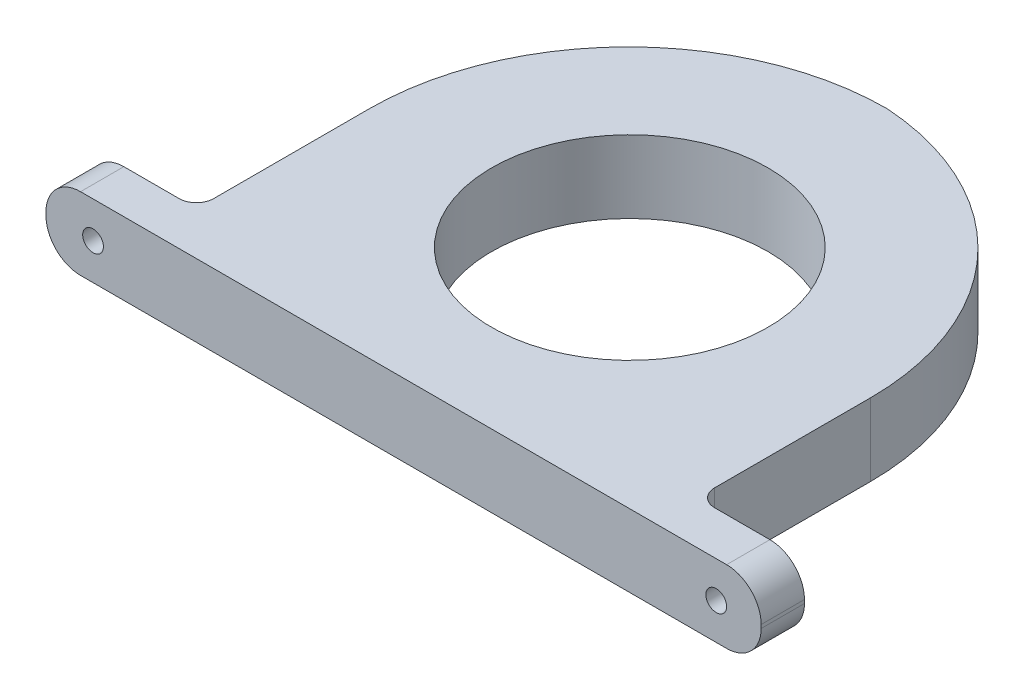
from build123d import *

# Parameters (mm, degrees)
SKETCH1_R           = 40
BOSS_EXTRUDE1_DEPTH = 21
FILLET1_R           = 10
FILLET2_R           = 10
FILLET3_R           = 10
FILLET4_R           = 10
FILLET5_R           = 5
FILLET6_R           = 5
FILLET7_R           = 75
FILLET8_R           = 75
SKETCH2_R           = 3
CUT_EXTRUDE1_DEPTH  = 164.836129338


with BuildPart() as part:
    # Sketch1 → Boss-Extrude1 (new body)
    with BuildSketch(Plane(origin=(0, 0, 0), x_dir=(1, 0, 0), z_dir=(0, 1, 0))):
        Polygon((0.191150297, -52.534941872), (103.191150297, -52.534941872), (103.191150297, -40), (72.191150297, -40), (72.191150297, 85), (0.191150297, 85), (-72.808849703, 85), (-72.808849703, -40), (-103.808849703, -40), (-103.808849703, -52.534941872), align=None)
        with Locations(Location((-0.308849703, 12.94638448, 0), (0, 0, 90))):
            Circle(SKETCH1_R, mode=Mode.SUBTRACT)
    extrude(amount=BOSS_EXTRUDE1_DEPTH)

    # Fillet1
    fillet1_edges = [part.edges().sort_by_distance(p)[0] for p in [
        (103.191150297, 21, 46.267470936),
    ]]
    fillet(fillet1_edges, radius=FILLET1_R)

    # Fillet2
    fillet2_edges = [part.edges().sort_by_distance(p)[0] for p in [
        (-103.808849703, 21, 46.267470936),
    ]]
    fillet(fillet2_edges, radius=FILLET2_R)

    # Fillet3
    fillet3_edges = [part.edges().sort_by_distance(p)[0] for p in [
        (-103.808849703, 0, 46.267470936),
    ]]
    fillet(fillet3_edges, radius=FILLET3_R)

    # Fillet4
    fillet4_edges = [part.edges().sort_by_distance(p)[0] for p in [
        (103.191150297, 0, 46.267470936),
    ]]
    fillet(fillet4_edges, radius=FILLET4_R)

    # Fillet5
    fillet5_edges = [part.edges().sort_by_distance(p)[0] for p in [
        (72.191150297, 10.5, 40),
    ]]
    fillet(fillet5_edges, radius=FILLET5_R)

    # Fillet6
    fillet6_edges = [part.edges().sort_by_distance(p)[0] for p in [
        (-72.808849703, 10.5, 40),
    ]]
    fillet(fillet6_edges, radius=FILLET6_R)

    # Fillet7
    fillet7_edges = [part.edges().sort_by_distance(p)[0] for p in [
        (-72.808849703, 10.5, -85),
    ]]
    fillet(fillet7_edges, radius=FILLET7_R)

    # Fillet8
    # the kernel refuses this fillet: 75 mm, written as the material it takes off along each edge
    with BuildSketch(Plane(origin=(72.191150297, -187.082869339, -85), x_dir=(-1, 0, 0), z_dir=(0, 1, 0))) as fillet8_piece_1:
        with BuildLine():
            CenterArc((75, 74.833147735), FILLET8_R, 180, 86.177446271)
            Line((0, 74.833147735), (-1.5, 74.833147735))
            Line((-1.5, 74.833147735), (-1.5, 0))
            Line((-1.5, 0), (0, -1.5))
            ThreePointArc((0, -1.5), (35, -1.5), (69.9, -1.496662955))
            Line((69.9, -1.496662955), (70, 0))
        make_face()
    extrude(amount=395.165738677, mode=Mode.SUBTRACT)

    # Sketch2 → Cut-Extrude1 (cut, through all)
    with BuildSketch(Plane(origin=(0, 0, 40), x_dir=(-1, 0, 0), z_dir=(0, 0, -1))):
        with Locations((-90.191150297, 10.5)):
            Circle(SKETCH2_R)
        with Locations(Location((90.191150297, 10.5, 0), (0, 0, 180))):
            Circle(SKETCH2_R)
    extrude(amount=-CUT_EXTRUDE1_DEPTH, mode=Mode.SUBTRACT)


solid = part.part
